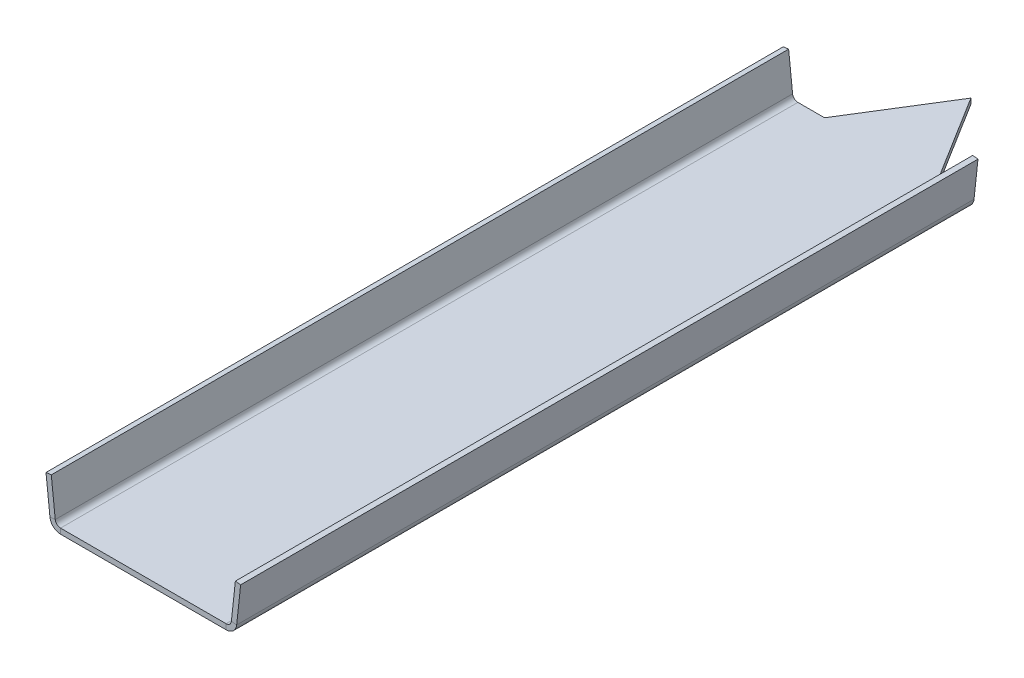
from build123d import *

# Parameters (mm, degrees)
TABAN_FLAN_1_DEPTH = 1110
SEKME1_DEPTH       = 8


# Sheet-metal steps are written as plain solids
with BuildPart() as part:
    # Çizim1 → Taban-Flanş1 (new body)
    with BuildSketch(Plane.XY):
        with BuildLine():
            Line((0, 0), (5.960525983, -55.31134025))
            ThreePointArc((5.960525983, -55.31134025), (11.177974486, -65.501435482), (21.868424162, -69.597054535))
            Line((21.868424162, -69.597054535), (271.131575838, -69.597054535))
            ThreePointArc((271.131575838, -69.597054535), (281.822025514, -65.501435482), (287.039474017, -55.31134025))
            Line((287.039474017, -55.31134025), (293, 0))
            Line((293, 0), (285.04605091, 0.857142857))
            Line((285.04605091, 0.857142857), (279.085524928, -54.454197393))
            ThreePointArc((279.085524928, -54.454197393), (276.476800676, -59.549245009), (271.131575838, -61.597054535))
            Line((271.131575838, -61.597054535), (21.868424162, -61.597054535))
            ThreePointArc((21.868424162, -61.597054535), (16.523199324, -59.549245009), (13.914475072, -54.454197393))
            Line((13.914475072, -54.454197393), (7.95394909, 0.857142857))
            Line((7.95394909, 0.857142857), (0, 0))
        make_face()
    extrude(amount=TABAN_FLAN_1_DEPTH)

    # Çizim6 → Sekme1 (add)
    with BuildSketch(Plane(origin=(0, -61.597054535, 0), x_dir=(1, 0, 0), z_dir=(0, 1, 0))):
        Polygon((62, 0), (146.5, 135.866662578), (231, 0), align=None)
    extrude(amount=-SEKME1_DEPTH)


solid = part.part
